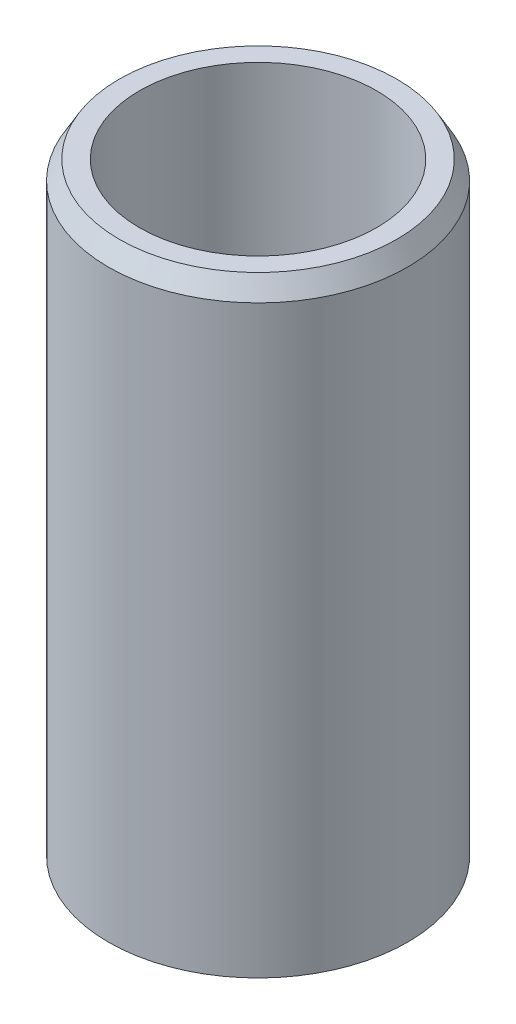
from build123d import *
from OCP.BRepFilletAPI import BRepFilletAPI_MakeChamfer

# Parameters (mm, degrees)
SKETCH1_R           = 42.5
BOSS_EXTRUDE1_DEPTH = 174.486426869
SKETCH2_R           = 33.708278227
CUT_EXTRUDE1_DEPTH  = 185.548132371
CHAMFER1_SIZE       = 5.31579861
CHAMFER1_SIZE2      = 3.069077759


with BuildPart() as part:
    # Sketch1 → Boss-Extrude1 (new body)
    with BuildSketch(Plane(origin=(0, 0, 0), x_dir=(1, 0, 0), z_dir=(0, 1, 0))):
        Circle(SKETCH1_R)
    extrude(amount=BOSS_EXTRUDE1_DEPTH)

    # Sketch2 → Cut-Extrude1 (cut, through all)
    with BuildSketch(Plane(origin=(0, 0, 0), x_dir=(1, 0, 0), z_dir=(0, 1, 0))):
        Circle(SKETCH2_R)
    extrude(amount=CUT_EXTRUDE1_DEPTH, mode=Mode.SUBTRACT)

    # Chamfer1: one chamfer whose edges measure the first distance from different faces: ONE call of the kernel's chamfer builder (chamfer() names one face for all edges)
    chamfer1_edges_1 = [part.edges().sort_by_distance(p)[0] for p in [
        (-42.5, 174.486426869, 0),
    ]]
    chamfer1_side_1 = [part.faces().sort_by_distance(p)[0] for p in [
        (-42.5, 87.243213435, 0),
    ]]
    chamfer1_edges_2 = [part.edges().sort_by_distance(p)[0] for p in [
        (-42.5, 0, 0),
    ]]
    chamfer1_side_2 = [part.faces().sort_by_distance(p)[0] for p in [
        (-41.297918472, 0, 0),
    ]]
    chamfer1 = BRepFilletAPI_MakeChamfer(part.part.solid().wrapped)
    for e in chamfer1_edges_1:
        chamfer1.Add(CHAMFER1_SIZE, CHAMFER1_SIZE2, e.wrapped, chamfer1_side_1[0].wrapped)  # the first distance lies on this face
    for e in chamfer1_edges_2:
        chamfer1.Add(CHAMFER1_SIZE, CHAMFER1_SIZE2, e.wrapped, chamfer1_side_2[0].wrapped)  # the first distance lies on this face
    add(Compound.cast(chamfer1.Shape()), mode=Mode.REPLACE)


solid = part.part
